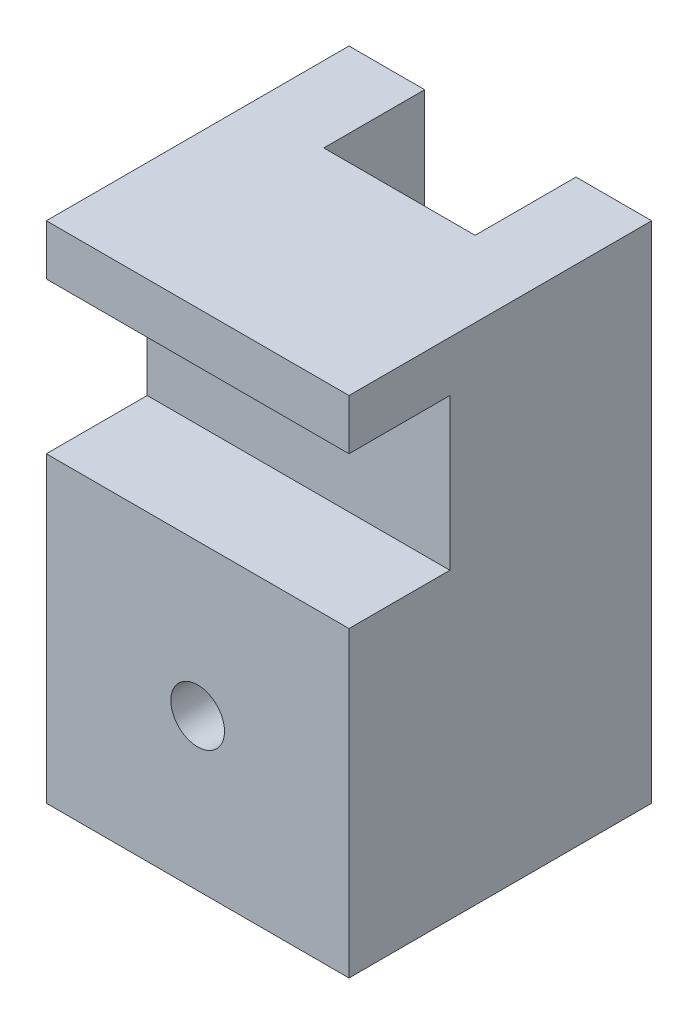
from build123d import *

# Parameters (mm, degrees)
SKETCH1_W                 = 38.1
SKETCH1_H                 = 63.5
BOSS_EXTRUDE1_DEPTH       = 19.05
SKETCH2_W                 = 19.05
SKETCH2_H                 = 63.5
CUT_EXTRUDE1_DEPTH        = 12.7
SKETCH3_W                 = 38.1
SKETCH3_H                 = 19.05
CUT_EXTRUDE2_DEPTH        = 12.7
F_1_4_CLEARANCE_HOLE1_D   = 6.7564
F_8_32_TAPPED_HOLE1_D     = 3.4544
F_8_32_TAPPED_HOLE1_DEPTH = 10.668
F_8_32_TAPPED_HOLE1_TIP   = 1.037806461


with BuildPart() as part:
    # Sketch1 → Boss-Extrude1 (new, symmetric)
    with BuildSketch(Plane.XY):
        Rectangle(SKETCH1_W, SKETCH1_H)
    extrude(amount=BOSS_EXTRUDE1_DEPTH, both=True)

    # Sketch2 → Cut-Extrude1 (cut)
    with BuildSketch(Plane(origin=(0, 0, -19.05), x_dir=(-1, 0, 0), z_dir=(0, 0, -1))):
        Rectangle(SKETCH2_W, SKETCH2_H)
    extrude(amount=-CUT_EXTRUDE1_DEPTH, mode=Mode.SUBTRACT)

    # Sketch3 → Cut-Extrude2 (cut)
    with BuildSketch(Plane.XY.offset(19.05)):
        with Locations((0, 15.875)):
            Rectangle(SKETCH3_W, SKETCH3_H)
    extrude(amount=-CUT_EXTRUDE2_DEPTH, mode=Mode.SUBTRACT)

    # 1/4 Clearance Hole1 (through all)
    with Locations(Plane.XY.offset(19.05)):
        with Locations((0, -12.7)):
            Hole(F_1_4_CLEARANCE_HOLE1_D / 2)

    # #8-32 Tapped Hole1
    with Locations(Plane.XY.offset(6.35)):
        with Locations((0, 15.875)):
            Hole(F_8_32_TAPPED_HOLE1_D / 2, depth=F_8_32_TAPPED_HOLE1_DEPTH)
            with Locations((0, 0, -(F_8_32_TAPPED_HOLE1_DEPTH + F_8_32_TAPPED_HOLE1_TIP / 2))):  # 118° drill point
                Cone(0, F_8_32_TAPPED_HOLE1_D / 2, F_8_32_TAPPED_HOLE1_TIP, mode=Mode.SUBTRACT)


solid = part.part
